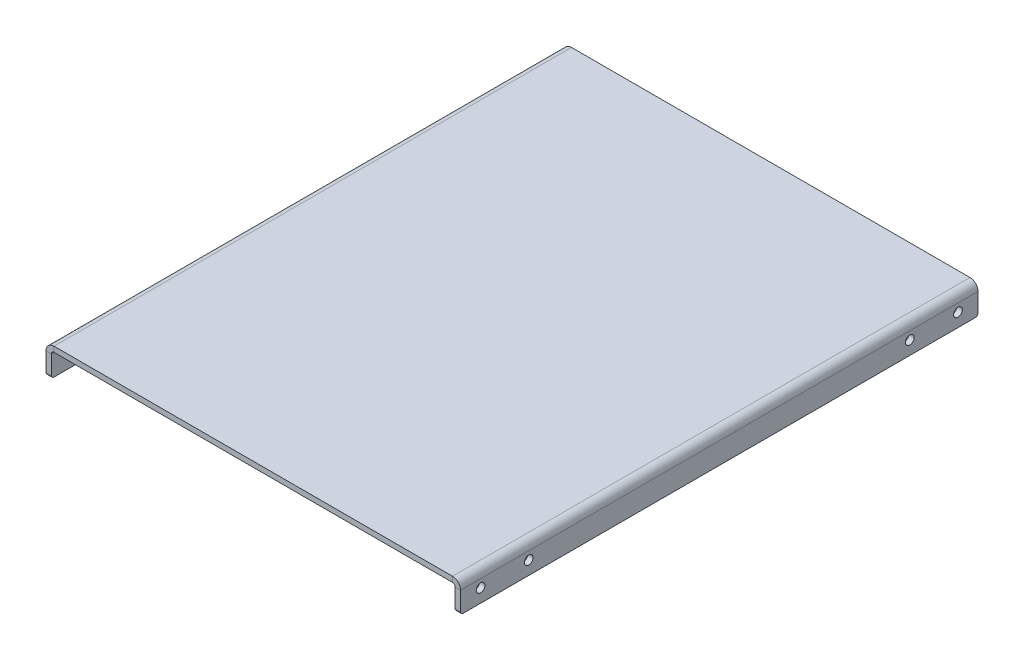
from build123d import *

# Parameters (mm, degrees)
EXTRUDE_THIN1_DEPTH        = 193.5
CONVERT_SOLID1_START       = -193.5
CONVERT_SOLID1_DEPTH       = 387
CONVERT_SOLID1_2_DEPTH     = 387
FILLET1_R                  = 2
F_6_5_6_5_DIAMETER_HOLE1_D = 6.5


# Read off the part's stored shape, not the designer's step: Convert-Solid1
with BuildPart() as part:
    # Sketch1 → Extrude-Thin1 (new, symmetric)
    with BuildSketch(Plane.XY):
        Polygon((-155, -22), (-155, 0), (155, 0), (155, -22), (151, -22), (151, -4), (-151, -4), (-151, -22), align=None)
    extrude(amount=EXTRUDE_THIN1_DEPTH, both=True)

    # Convert-Solid1 outline → Convert-Solid1 (cut)
    with BuildSketch(Plane.XY.offset(CONVERT_SOLID1_START)):
        with BuildLine():
            Line((155, 0), (149, 0))
            ThreePointArc((149, 0), (153.242640687, -1.757359313), (155, -6))
            Line((155, -6), (155, 0))
        make_face()
        with BuildLine():
            ThreePointArc((-155, -6), (-153.242640687, -1.757359313), (-149, 0))
            Line((-149, 0), (-155, 0))
            Line((-155, 0), (-155, -6))
        make_face()
    extrude(amount=CONVERT_SOLID1_DEPTH, mode=Mode.SUBTRACT)

    # Convert-Solid1 2 outline → Convert-Solid1 2 (add)
    with BuildSketch(Plane.XY.offset(CONVERT_SOLID1_START)):
        with BuildLine():
            Line((151, -4), (149, -4))
            ThreePointArc((149, -4), (150.414213562, -4.585786438), (151, -6))
            Line((151, -6), (151, -4))
        make_face()
        with BuildLine():
            ThreePointArc((-151, -6), (-150.414213562, -4.585786438), (-149, -4))
            Line((-149, -4), (-151, -4))
            Line((-151, -4), (-151, -6))
        make_face()
    extrude(amount=CONVERT_SOLID1_2_DEPTH)

    # Fillet1
    fillet1_edges = [part.edges().sort_by_distance(p)[0] for p in [
        (153, -22, 193.5),
        (153, -22, -193.5),
        (-153, -22, -193.5),
        (-153, -22, 193.5),
    ]]
    fillet(fillet1_edges, radius=FILLET1_R)

    # Ø6.5 (6.5) Diameter Hole1 (through all)
    with Locations(Plane(origin=(159, 0, 0), x_dir=(0, 0, -1), z_dir=(1, 0, 0))):
        with Locations((-178.5, -12), (-142.5, -12), (142.5, -12), (178.5, -12)):
            Hole(F_6_5_6_5_DIAMETER_HOLE1_D / 2)


solid = part.part
